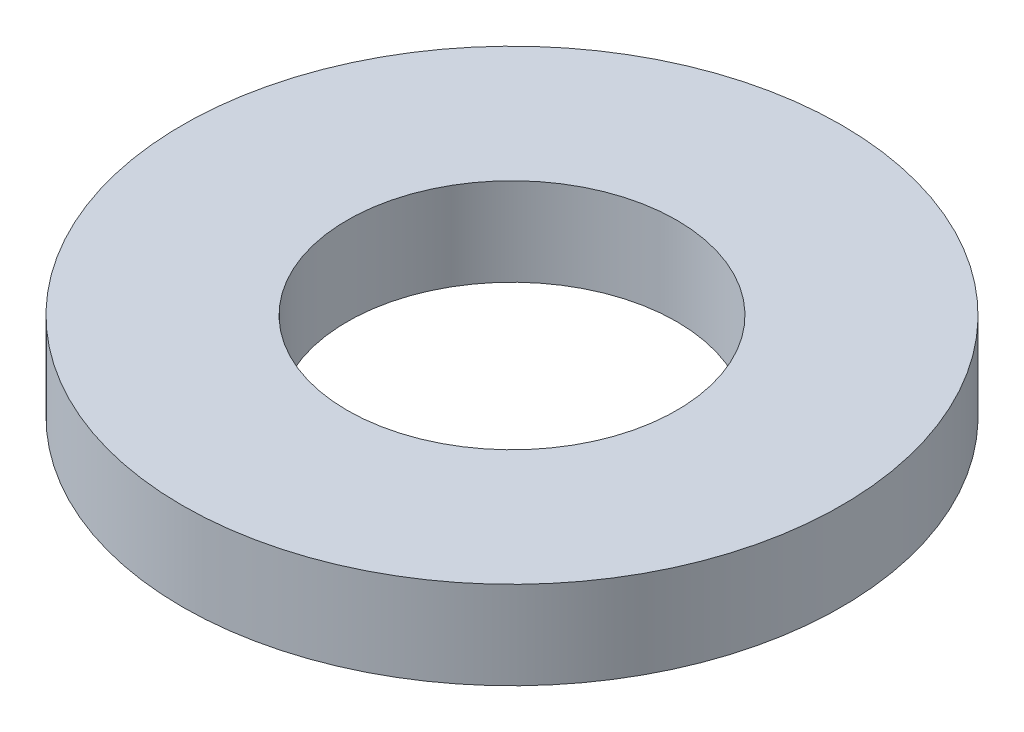
from build123d import *

# Parameters (mm, degrees)
SKETCH_1_R      = 3
SKETCH_1_R_2    = 1.5
EXTRUDE_1_DEPTH = 0.4


with BuildPart() as part:
    # 草图1 → 凸台-拉伸1 (new, symmetric)
    with BuildSketch(Plane(origin=(0, 0, 0), x_dir=(1, 0, 0), z_dir=(0, 1, 0))):
        Circle(SKETCH_1_R)
        Circle(SKETCH_1_R_2, mode=Mode.SUBTRACT)
    extrude(amount=EXTRUDE_1_DEPTH, both=True)


solid = part.part
